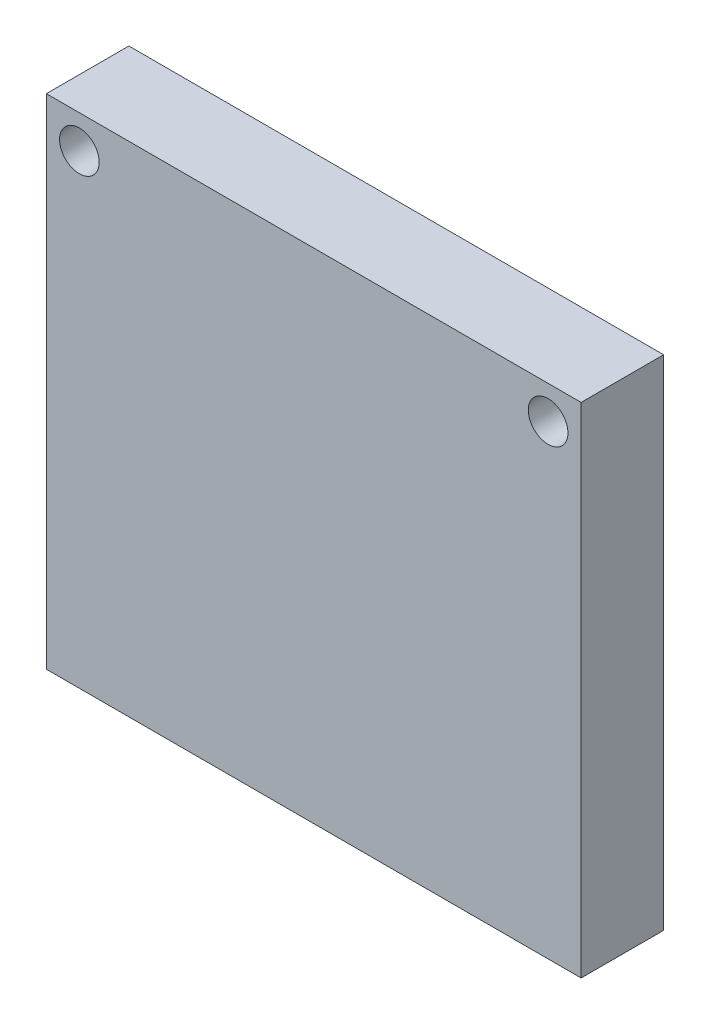
from build123d import *

# Parameters (mm, degrees)
SKETCH1_W           = 16.2
SKETCH1_H           = 15.1
BOSS_EXTRUDE1_DEPTH = 2.5


with BuildPart() as part:
    # Sketch1 → Boss-Extrude1 (new body)
    with BuildSketch(Plane.XY):
        Rectangle(SKETCH1_W, SKETCH1_H)
    extrude(amount=BOSS_EXTRUDE1_DEPTH)

    # Sketch3 → M1 Clearance Hole1 (revolve, cut)
    with BuildSketch(Plane(origin=(7.1, 6.55, 2.5), x_dir=(0, -1, 0), z_dir=(1, 0, 0))):
        Polygon((0, 0), (0, 3.510516371), (0.6, 3.15), (0.6, 0), align=None)
    m1_clearance_hole1 = revolve(axis=Axis((7.1, 6.55, 8.85), (0, 0, -1)), mode=Mode.SUBTRACT)

    # Mirror1: M1 Clearance Hole1 across plane
    add(m1_clearance_hole1.mirror(Plane(origin=(0, 0, 0), x_dir=(0, 0, 1), z_dir=(1, 0, 0))), mode=Mode.SUBTRACT)


solid = part.part
